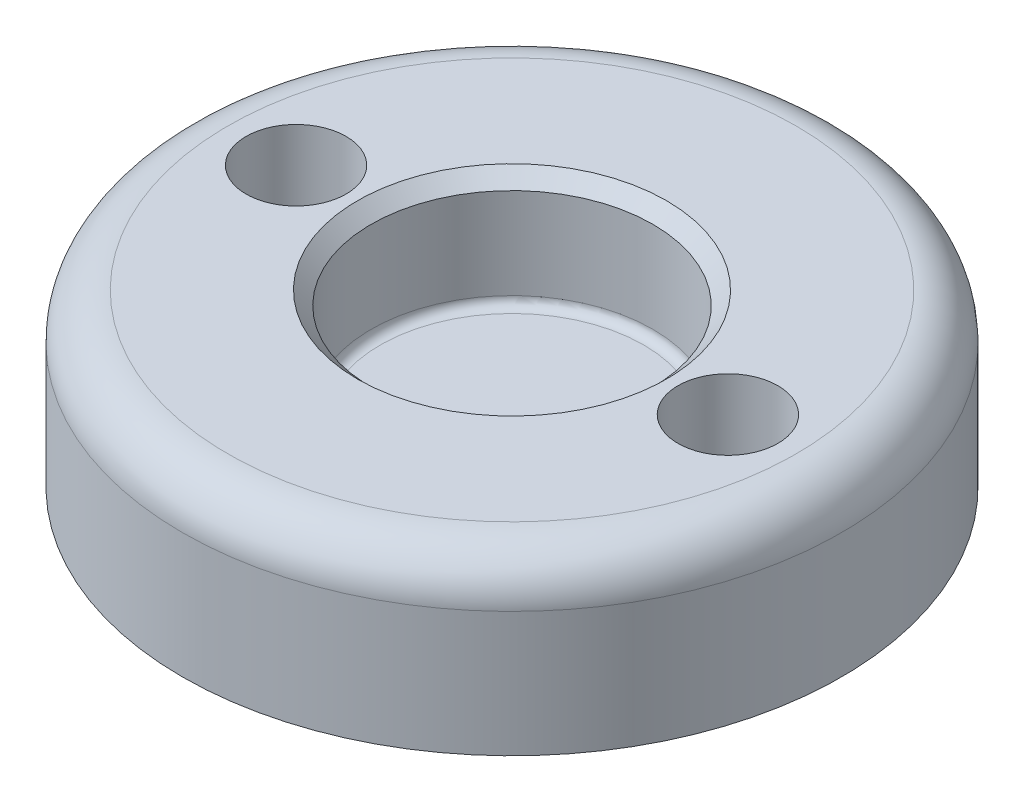
from build123d import *

# Parameters (mm, degrees)
CHAMFER2_SIZE     = 0.3
CIRPATTERN1_COUNT = 2
FILLET2_R         = 0.2
FILLET3_R         = 1


with BuildPart() as part:
    # Sketch1 → Revolve1 (revolve)
    with BuildSketch(Plane.XY):
        Polygon((0, 0), (-7.25, 0), (-7.25, 3.75), (-3.1, 3.75), (-3.1, 1.25), (0, 1.25), align=None)
    revolve(axis=Axis((0, 0, 0), (0, 1, 0)))

    # Chamfer2
    chamfer2_edges = [part.edges().sort_by_distance(p)[0] for p in [
        (3.1, 3.75, 0),
    ]]
    chamfer(chamfer2_edges, length=CHAMFER2_SIZE)

    # Sketch4 → CSK for M2 Flat Head Machine Screw1 (revolve, cut)
    with BuildSketch(Plane(origin=(-4.75, 0, 0), x_dir=(0, 0, -1), z_dir=(1, 0, 0))):
        Polygon((0, 0), (0, 5.660946681), (1.1, 5), (1.1, 1.1), (2.2, 0), align=None)
    csk_for_m2_flat_head_machine_screw1 = revolve(axis=Axis((-4.75, -6.35, 0), (0, 1, 0)), mode=Mode.SUBTRACT)

    # CirPattern1: CSK for M2 Flat Head Machine Screw1 ×2 about axis
    cirpattern1_axis = Axis((0, 0, 0), (0, -1, 0))
    for i in range(1, CIRPATTERN1_COUNT):
        add(csk_for_m2_flat_head_machine_screw1.rotate(cirpattern1_axis, i * 360 / CIRPATTERN1_COUNT), mode=Mode.SUBTRACT)

    # Fillet2
    fillet2_edges = [part.edges().sort_by_distance(p)[0] for p in [
        (3.1, 1.25, 0),
    ]]
    fillet(fillet2_edges, radius=FILLET2_R)

    # Fillet3
    fillet3_edges = [part.edges().sort_by_distance(p)[0] for p in [
        (7.25, 3.75, 0),
    ]]
    fillet(fillet3_edges, radius=FILLET3_R)


solid = part.part
